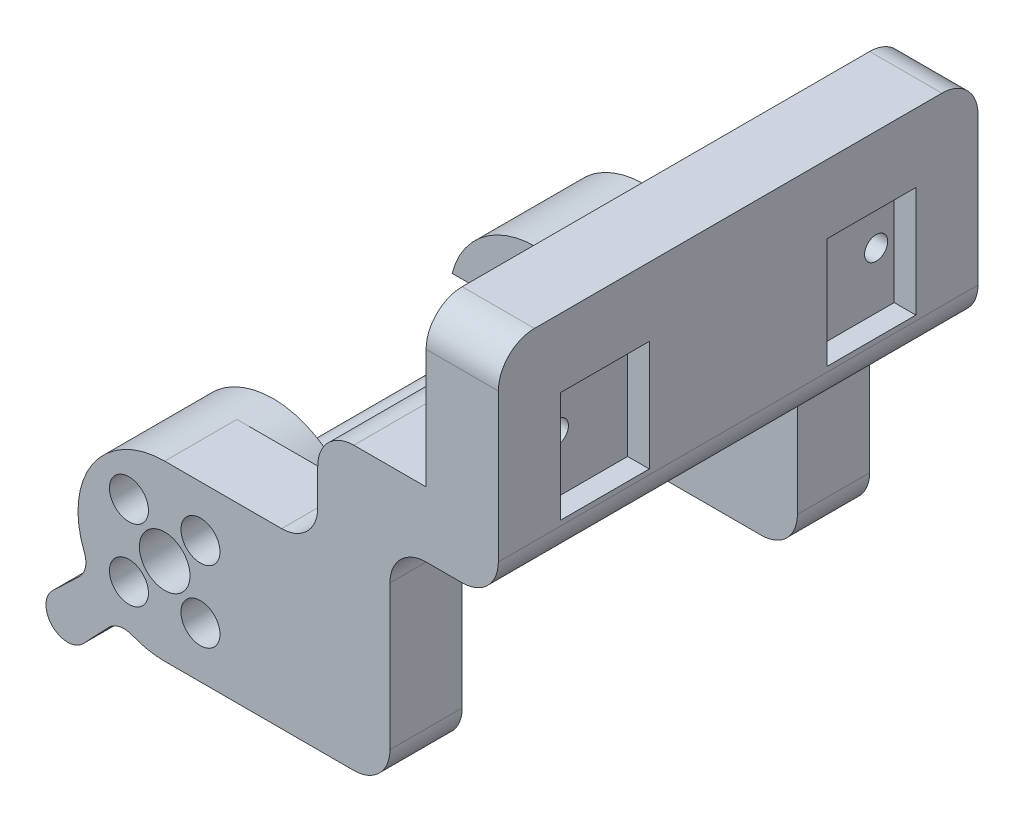
from build123d import *

# Parameters (mm, degrees)
EXTRUDE_1_DEPTH      = 13.5
SKETCH_5_R           = 10.1
CUT_EXTRUDE_2_DEPTH  = 1.5
SKETCH_7_R           = 3.5
CUT_EXTRUDE_3_DEPTH  = 37
SKETCH_9_R           = 1.5
CUT_EXTRUDE_4_DEPTH  = 24.5
SKETCH_11_W          = 60.4
SKETCH_11_H          = 24
EXTRUDE_2_DEPTH      = 25
SKETCH_12_R          = 2.7
CUT_EXTRUDE_5_DEPTH  = 8.5
SKETCH_18_R          = 12
CUT_EXTRUDE_9_DEPTH  = 1.5
SKETCH_19_W          = 14.67242397
SKETCH_19_H          = 6
CUT_EXTRUDE_10_DEPTH = 3
SKETCH_20_W          = 76.507524202
SKETCH_20_H          = 37.102074034
CUT_EXTRUDE_11_DEPTH = 3.5
SKETCH_21_R          = 2.7
SKETCH_21_R_2        = 3.5
EXTRUDE_3_DEPTH      = 6.5
CUT_EXTRUDE_12_DEPTH = 6.5
SKETCH_23_W          = 10
SKETCH_23_H          = 66.4
EXTRUDE_4_DEPTH      = 30
SKETCH_24_W          = 25
SKETCH_24_H          = 66.4
EXTRUDE_5_DEPTH      = 15
SKETCH_25_W          = 12.3
SKETCH_25_H          = 15.3
CUT_EXTRUDE_13_DEPTH = 3
SKETCH_26_R          = 1.6
CUT_EXTRUDE_14_DEPTH = 20
SKETCH_27_W          = 46.4
SKETCH_27_H          = 30
CUT_EXTRUDE_15_DEPTH = 47
SKETCH_28_W          = 66.4
SKETCH_28_H          = 30
CUT_EXTRUDE_16_DEPTH = 15
SKETCH_29_W          = 10
SKETCH_29_H          = 66.4
EXTRUDE_6_DEPTH      = 6.5
SKETCH_30_R          = 3
EXTRUDE_7_DEPTH      = 66.4
EXTRUDE_8_DEPTH      = 15
EXTRUDE_9_DEPTH      = 15
FILLET_9_R           = 3
EXTRUDE_10_DEPTH     = 5
SKETCH_34_W          = 66.4
SKETCH_34_H          = 30
CUT_EXTRUDE_17_DEPTH = 15
SKETCH_35_W          = 66.4
SKETCH_35_H          = 21.5
SKETCH_35_R          = 1.6
EXTRUDE_11_DEPTH     = 15
SKETCH_36_W          = 12.3
SKETCH_36_H          = 15.3
SKETCH_36_R          = 1.6
CUT_EXTRUDE_18_DEPTH = 15
SKETCH_37_W          = 66.4
SKETCH_37_H          = 30.5
CUT_EXTRUDE_19_DEPTH = 15
FILLET_10_R          = 5
FILLET_11_R          = 5


with BuildPart() as part:
    # 草图1 → 凸台-拉伸1 (new body)
    with BuildSketch(Plane.XY):
        with BuildLine():
            Line((0, 12), (36.185307738, 12))
            Line((36.185307738, 12), (36.185307738, -12))
            Line((36.185307738, -12), (0, -12))
            ThreePointArc((0, -12), (-12, 0), (0, 12))
        make_face()
    extrude(amount=EXTRUDE_1_DEPTH)

    # 草图5 → 切除-拉伸2 (cut)
    with BuildSketch(Plane(origin=(0, 0, 0), x_dir=(-1, 0, 0), z_dir=(0, 0, -1))):
        Circle(SKETCH_5_R)
    extrude(amount=-CUT_EXTRUDE_2_DEPTH, mode=Mode.SUBTRACT)

    # 草图7 → 切除-拉伸3 (cut)
    with BuildSketch(Plane(origin=(0, 0, 1.5), x_dir=(-1, 0, 0), z_dir=(0, 0, -1))):
        Circle(SKETCH_7_R)
    extrude(amount=-CUT_EXTRUDE_3_DEPTH, mode=Mode.SUBTRACT)

    # 草图9 → 切除-拉伸4 (cut)
    with BuildSketch(Plane(origin=(0, 0, 1.5), x_dir=(-1, 0, 0), z_dir=(0, 0, -1))):
        with Locations((-4.949747468, 4.949747468)):
            Circle(SKETCH_9_R)
        with Locations((4.949747468, 4.949747468)):
            Circle(SKETCH_9_R)
        with Locations((4.949747468, -4.949747468)):
            Circle(SKETCH_9_R)
        with Locations((-4.949747468, -4.949747468)):
            Circle(SKETCH_9_R)
    extrude(amount=-CUT_EXTRUDE_4_DEPTH, mode=Mode.SUBTRACT)


with BuildPart() as body_2:
    # 镜向14: mirrored copy
    add(part.part.mirror(Plane(origin=(0, 0, -16.7), x_dir=(1, 0, 0), z_dir=(0, 0, -1))))


with BuildPart() as part_1:
    add(part.part)

    add(body_2.part)  # 凸台-拉伸2 merges body 2
    # 草图11 → 凸台-拉伸2 (add)
    with BuildSketch(Plane(origin=(36.185307738, 0, 0), x_dir=(0, 0, -1), z_dir=(1, 0, 0))):
        with Locations((16.7, 0)):
            Rectangle(SKETCH_11_W, SKETCH_11_H)
    extrude(amount=EXTRUDE_2_DEPTH)

    # 草图12 → 切除-拉伸5 (cut)
    with BuildSketch(Plane.XY.offset(13.5)):
        with Locations((4.949747468, 4.949747468)):
            Circle(SKETCH_12_R)
        with Locations((4.949747468, -4.949747468)):
            Circle(SKETCH_12_R)
        with Locations((-4.949747468, -4.949747468)):
            Circle(SKETCH_12_R)
        with Locations((-4.949747468, 4.949747468)):
            Circle(SKETCH_12_R)
    cut_extrude_5 = extrude(amount=-CUT_EXTRUDE_5_DEPTH, mode=Mode.SUBTRACT)

    # 草图18 → 切除-拉伸9 (cut)
    with BuildSketch(Plane(origin=(0, 0, 0), x_dir=(-1, 0, 0), z_dir=(0, 0, -1))):
        Circle(SKETCH_18_R)
    cut_extrude_9 = extrude(amount=-CUT_EXTRUDE_9_DEPTH, mode=Mode.SUBTRACT)

    # 草图19 → 切除-拉伸10 (cut)
    with BuildSketch(Plane(origin=(0, 0, 1.5), x_dir=(-1, 0, 0), z_dir=(0, 0, -1))):
        with Locations((7.336211985, 0)):
            Rectangle(SKETCH_19_W, SKETCH_19_H)
    cut_extrude_10 = extrude(amount=-CUT_EXTRUDE_10_DEPTH, mode=Mode.SUBTRACT)

    # 草图20 → 切除-拉伸11 (cut)
    with BuildSketch(Plane.XY.offset(13.5)):
        with Locations((20.283666709, 0.248055891)):
            Rectangle(SKETCH_20_W, SKETCH_20_H)
    cut_extrude_11 = extrude(amount=-CUT_EXTRUDE_11_DEPTH, mode=Mode.SUBTRACT)

    # 镜向24: 切除-拉伸5, 切除-拉伸9, 切除-拉伸10 across plane
    add(cut_extrude_5.mirror(Plane(origin=(0, 0, -16.7), x_dir=(1, 0, 0), z_dir=(0, 0, -1))), mode=Mode.SUBTRACT)
    add(cut_extrude_9.mirror(Plane(origin=(0, 0, -16.7), x_dir=(1, 0, 0), z_dir=(0, 0, -1))), mode=Mode.SUBTRACT)
    add(cut_extrude_10.mirror(Plane(origin=(0, 0, -16.7), x_dir=(1, 0, 0), z_dir=(0, 0, -1))), mode=Mode.SUBTRACT)

    # 镜向26: 切除-拉伸11 across plane
    add(cut_extrude_11.mirror(Plane(origin=(0, 0, -16.7), x_dir=(1, 0, 0), z_dir=(0, 0, -1))), mode=Mode.SUBTRACT)

    # 草图21 → 凸台-拉伸3 (add)
    with BuildSketch(Plane(origin=(0, 0, -43.4), x_dir=(-1, 0, 0), z_dir=(0, 0, -1))):
        with BuildLine():
            Line((0, 12), (-61.185307738, 12))
            Line((-61.185307738, 12), (-61.185307738, -12))
            Line((-61.185307738, -12), (0, -12))
            ThreePointArc((0, -12), (12, 0), (0, 12))
        make_face()
        with Locations((4.949747468, -4.949747468)):
            Circle(SKETCH_21_R, mode=Mode.SUBTRACT)
        Circle(SKETCH_21_R_2, mode=Mode.SUBTRACT)
        with Locations((4.949747468, 4.949747468)):
            Circle(SKETCH_21_R, mode=Mode.SUBTRACT)
        with Locations((-4.949747468, 4.949747468)):
            Circle(SKETCH_21_R, mode=Mode.SUBTRACT)
        with Locations((-4.949747468, -4.949747468)):
            Circle(SKETCH_21_R, mode=Mode.SUBTRACT)
    extrude_3 = extrude(amount=EXTRUDE_3_DEPTH)

    # 草图22 → 切除-拉伸12 (cut)
    with BuildSketch(Plane.XY.offset(-33.4)):
        with BuildLine():
            Line((0, -12), (36.185307738, -12))
            Line((36.185307738, -12), (36.185307738, 12))
            Line((36.185307738, 12), (0, 12))
            ThreePointArc((0, 12), (12, 0), (0, -12))
        make_face()
    cut_extrude_12 = extrude(amount=-CUT_EXTRUDE_12_DEPTH, mode=Mode.SUBTRACT)

    # 镜向27: 凸台-拉伸3, 切除-拉伸12 across plane
    add(extrude_3.mirror(Plane(origin=(0, 0, -16.7), x_dir=(1, 0, 0), z_dir=(0, 0, -1))))
    add(cut_extrude_12.mirror(Plane(origin=(0, 0, -16.7), x_dir=(1, 0, 0), z_dir=(0, 0, -1))), mode=Mode.SUBTRACT)

    # 草图23 → 凸台-拉伸4 (add)
    with BuildSketch(Plane(origin=(0, 12, 0), x_dir=(1, 0, 0), z_dir=(0, 1, 0))):
        with Locations((56.185307738, 16.7)):
            Rectangle(SKETCH_23_W, SKETCH_23_H)
    extrude(amount=EXTRUDE_4_DEPTH)

    # 草图24 → 凸台-拉伸5 (add)
    with BuildSketch(Plane(origin=(0, 12, 0), x_dir=(1, 0, 0), z_dir=(0, 1, 0))):
        with Locations((38.685307738, 16.7)):
            Rectangle(SKETCH_24_W, SKETCH_24_H)
    extrude(amount=EXTRUDE_5_DEPTH)

    # 草图25 → 切除-拉伸13 (cut)
    with BuildSketch(Plane(origin=(61.185307738, 0, 0), x_dir=(0, 0, -1), z_dir=(1, 0, 0))):
        with Locations((-1.75, 31.35)):
            Rectangle(SKETCH_25_W, SKETCH_25_H)
    cut_extrude_13 = extrude(amount=-CUT_EXTRUDE_13_DEPTH, mode=Mode.SUBTRACT)

    # 草图26 → 切除-拉伸14 (cut)
    with BuildSketch(Plane(origin=(58.185307738, 0, 0), x_dir=(0, 0, -1), z_dir=(1, 0, 0))):
        with Locations((-5.4, 31.5)):
            Circle(SKETCH_26_R)
    cut_extrude_14 = extrude(amount=-CUT_EXTRUDE_14_DEPTH, mode=Mode.SUBTRACT)

    # 镜向28: 切除-拉伸13, 切除-拉伸14 across plane
    add(cut_extrude_13.mirror(Plane(origin=(0, 0, -16.7), x_dir=(1, 0, 0), z_dir=(0, 0, -1))), mode=Mode.SUBTRACT)
    add(cut_extrude_14.mirror(Plane(origin=(0, 0, -16.7), x_dir=(1, 0, 0), z_dir=(0, 0, -1))), mode=Mode.SUBTRACT)

    # 草图27 → 切除-拉伸15 (cut)
    with BuildSketch(Plane(origin=(61.185307738, 0, 0), x_dir=(0, 0, -1), z_dir=(1, 0, 0))):
        with Locations((16.7, 3)):
            Rectangle(SKETCH_27_W, SKETCH_27_H)
    extrude(amount=-CUT_EXTRUDE_15_DEPTH, mode=Mode.SUBTRACT)

    # 草图28 → 切除-拉伸16 (cut)
    with BuildSketch(Plane(origin=(61.185307738, 0, 0), x_dir=(0, 0, -1), z_dir=(1, 0, 0))):
        with Locations((16.7, 3)):
            Rectangle(SKETCH_28_W, SKETCH_28_H)
    extrude(amount=-CUT_EXTRUDE_16_DEPTH, mode=Mode.SUBTRACT)

    # 草图29 → 凸台-拉伸6 (add)
    with BuildSketch(Plane(origin=(0, 42, 0), x_dir=(1, 0, 0), z_dir=(0, 1, 0))):
        with Locations((56.185307738, 16.7)):
            Rectangle(SKETCH_29_W, SKETCH_29_H)
    extrude(amount=EXTRUDE_6_DEPTH)



with BuildPart() as body_2_2:
    # 草图30 → 凸台-拉伸7 (new body)
    with BuildSketch(Plane.XY.offset(16.5)):
        with Locations((-13.435028843, -13.435028843)):
            Circle(SKETCH_30_R)
    extrude(amount=-EXTRUDE_7_DEPTH)


with BuildPart() as part_2:
    add(part_1.part)

    add(body_2_2.part)  # 凸台-拉伸8 merges body 2 2
    # 草图31 → 凸台-拉伸8 (add)
    with BuildSketch(Plane.XY.offset(16.5)):
        with BuildLine():
            Line((-15.502653161, -11.261338507), (-10.227205569, -6.243308314))
            ThreePointArc((-10.227205569, -6.243308314), (-8.472739594, -8.472739594), (-6.243308314, -10.227205569))
            Line((-6.243308314, -10.227205569), (-11.261338507, -15.502653161))
            ThreePointArc((-11.261338507, -15.502653161), (-11.313708499, -11.313708499), (-15.502653161, -11.261338507))
        make_face()
    extrude(amount=-EXTRUDE_8_DEPTH)

    # 草图32 → 凸台-拉伸9 (add)
    with BuildSketch(Plane(origin=(0, 0, -49.9), x_dir=(-1, 0, 0), z_dir=(0, 0, -1))):
        with BuildLine():
            Line((11.261338507, -15.502653161), (6.255813007, -10.240351733))
            ThreePointArc((6.255813007, -10.240351733), (8.485281374, -8.485281374), (10.240351733, -6.255813007))
            Line((10.240351733, -6.255813007), (15.502653161, -11.261338507))
            ThreePointArc((15.502653161, -11.261338507), (11.313708499, -11.313708499), (11.261338507, -15.502653161))
        make_face()
    extrude(amount=-EXTRUDE_9_DEPTH)

    # 圆角9
    # the kernel refuses this fillet: 3 mm, written as the material it adds along each edge
    with BuildSketch(Plane(origin=(-6.255813007, -10.240351733, 16.5), x_dir=(-0.6892081062502396, -0.724563445309628, 0), z_dir=(0, 0, -1))) as fillet_9_piece_1:
        with BuildLine():
            CenterArc((2.214065381, -3), FILLET_9_R, 90, 68.387133701)
            ThreePointArc((-0.575016009, -1.895), (-0.248350543, -0.959381882), (0, 0))
            Line((0, 0), (2.214065381, 0))
        make_face()
    extrude(amount=15)
    with BuildSketch(Plane(origin=(-10.240351733, -6.255813007, 16.5), x_dir=(-0.44912622978697236, 0.8934683148927777, 0), z_dir=(0, 0, -1)), Plane(origin=(-6.255813007, -10.240351733, -49.9), x_dir=(0.8934683148928326, -0.44912622978686306, 0), z_dir=(0, 0, 1))) as fillet_9_piece_2:
        with BuildLine():
            CenterArc((2.227860315, -2.989769879), FILLET_9_R, 94.733047606, 68.387133701)
            Line((-0.642887442, -2.118674409), (0, 0))
            ThreePointArc((0, 0), (0.99016014, -0.040920483), (1.98032028, 0))
        make_face()
    extrude(amount=15)
    with BuildSketch(Plane(origin=(-10.240351733, -6.255813007, -49.9), x_dir=(-0.449126229786972, 0.8934683148927778, 0), z_dir=(0, 0, 1))) as fillet_9_piece_3:
        with BuildLine():
            CenterArc((2.227860315, 2.989769879), FILLET_9_R, 196.879818692, 68.387133701)
            Line((-0.642887442, 2.118674409), (0, 0))
            ThreePointArc((0, 0), (0.99016014, 0.040920483), (1.98032028, 0))
        make_face()
    extrude(amount=15)

    # 草图33 → 凸台-拉伸10 (add)
    with BuildSketch(Plane.ZY.offset(-26.185307738)):
        Polygon((-39.9, 18), (6.5, 18), (6.5, 12), (16.5, 12), (16.5, 27), (-49.9, 27), (-49.9, 12), (-39.9, 12), align=None)
    extrude(amount=EXTRUDE_10_DEPTH)

    # 草图34 → 切除-拉伸17 (cut)
    with BuildSketch(Plane(origin=(46.185307738, 0, 0), x_dir=(0, 0, -1), z_dir=(1, 0, 0))):
        with Locations((16.7, 3)):
            Rectangle(SKETCH_34_W, SKETCH_34_H)
    extrude(amount=-CUT_EXTRUDE_17_DEPTH, mode=Mode.SUBTRACT)

    # 草图35 → 凸台-拉伸11 (add)
    with BuildSketch(Plane.ZY.offset(-51.185307738)):
        with Locations((-16.7, 37.75)):
            Rectangle(SKETCH_35_W, SKETCH_35_H)
        with Locations(Location((5.4, 31.5, 0), (0, 0, 180))):
            Circle(SKETCH_35_R, mode=Mode.SUBTRACT)
        with Locations(Location((-38.8, 31.5, 0), (0, 0, 180))):
            Circle(SKETCH_35_R, mode=Mode.SUBTRACT)
    extrude(amount=EXTRUDE_11_DEPTH)

    # 草图36 → 切除-拉伸18 (cut)
    # profile 1 of 2: a face of its own
    with BuildSketch(Plane(origin=(58.185307738, 0, 0), x_dir=(0, 0, -1), z_dir=(1, 0, 0))):
        with Locations((35.15, 31.35)):
            Rectangle(SKETCH_36_W, SKETCH_36_H)
        with Locations((38.8, 31.5)):
            Circle(SKETCH_36_R, mode=Mode.SUBTRACT)
    # profile 2 of 2: a face of its own
    with BuildSketch(Plane(origin=(58.185307738, 0, 0), x_dir=(0, 0, -1), z_dir=(1, 0, 0))):
        with Locations((-1.75, 31.35)):
            Rectangle(SKETCH_36_W, SKETCH_36_H)
        with Locations((-5.4, 31.5)):
            Circle(SKETCH_36_R, mode=Mode.SUBTRACT)
    extrude(amount=-CUT_EXTRUDE_18_DEPTH, mode=Mode.SUBTRACT)

    # 草图37 → 切除-拉伸19 (cut)
    with BuildSketch(Plane(origin=(61.185307738, 0, 0), x_dir=(0, 0, -1), z_dir=(1, 0, 0))):
        with Locations((16.7, 33.25)):
            Rectangle(SKETCH_37_W, SKETCH_37_H)
    extrude(amount=-CUT_EXTRUDE_19_DEPTH, mode=Mode.SUBTRACT)

    # 圆角10
    fillet_10_edges = [part_2.edges().sort_by_distance(p)[0] for p in [
        (41.185307738, 48.5, 16.5),
        (21.185307738, 12, 11.5),
        (21.185307738, 27, -16.7),
        (21.185307738, 12, -44.9),
        (31.185307738, 18, -44.9),
        (31.185307738, -12, -44.9),
        (31.185307738, 18, 11.5),
        (31.185307738, -12, 11.5),
        (41.185307738, 48.5, -49.9),
        (46.185307738, 18, -16.7),
    ]]
    fillet(fillet_10_edges, radius=FILLET_10_R)

    # 圆角11
    fillet_11_edges = [part_2.edges().sort_by_distance(p)[0] for p in [
        (28.685307738, 18, -39.9),
        (31.185307738, 18, 6.5),
    ]]
    fillet(fillet_11_edges, radius=FILLET_11_R)


solid = part_2.part
